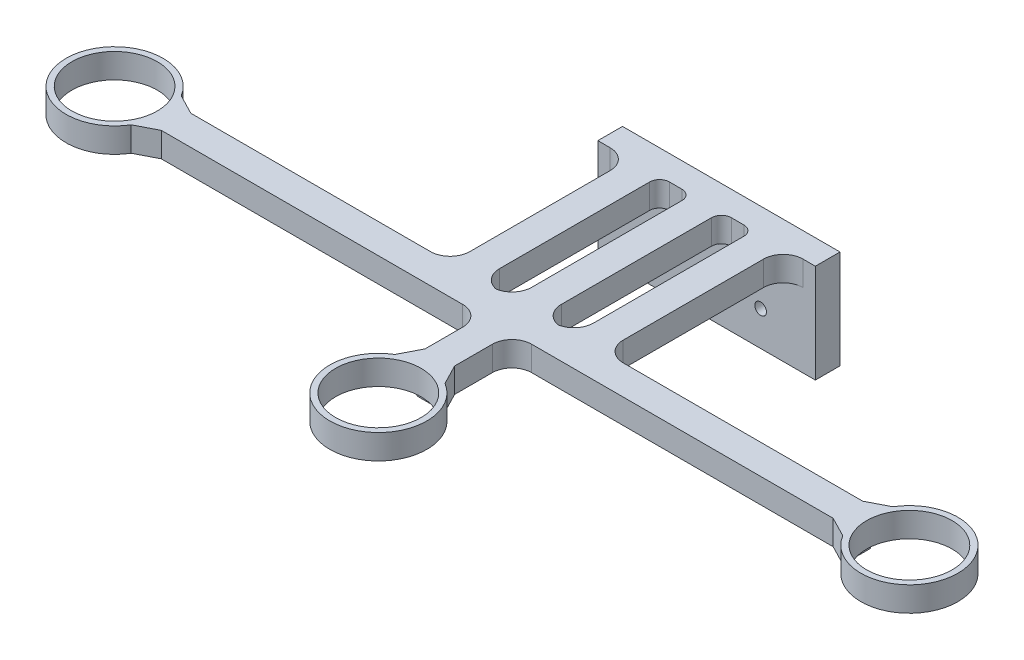
from build123d import *

# Parameters (mm, degrees)
SKETCH1_W           = 55.99938
SKETCH1_H           = 25.4
BOSS_EXTRUDE1_DEPTH = 6.35
BOSS_EXTRUDE2_DEPTH = 6.35
SKETCH10_R          = 10.999999971
CUT_EXTRUDE3_DEPTH  = 179.12779542
FILLET1_R           = 5.08
FILLET2_R           = 5.08
FILLET3_R           = 5.08
FILLET4_R           = 5.08
FILLET5_R           = 5.08
FILLET6_R           = 5.08
FILLET7_R           = 2.54
SKETCH9_R           = 1.5
CUT_EXTRUDE2_DEPTH  = 175.519471736
BOSS_EXTRUDE3_DEPTH = 1.27
FILLET8_R           = 1.27
CHAMFER1_SIZE       = 3.922074982
CHAMFER3_SIZE       = 3.922074982
CHAMFER4_SIZE       = 3.922074982


with BuildPart() as part:
    # Sketch1 → Boss-Extrude1 (new body)
    with BuildSketch(Plane.XY):
        with Locations((27.99969, -12.7)):
            Rectangle(SKETCH1_W, SKETCH1_H)
    extrude(amount=BOSS_EXTRUDE1_DEPTH)

    # Sketch2 → Boss-Extrude2 (add)
    with BuildSketch(Plane(origin=(0, 0, 0), x_dir=(1, 0, 0), z_dir=(0, 1, 0))):
        with BuildLine():
            ThreePointArc((118.420471835, -60.26605485), (142.825676579, -56.45605485), (118.420471835, -52.64605485))
            Line((118.420471835, -52.64605485), (47.74438, -52.64605485))
            Line((47.74438, -52.64605485), (47.74438, -6.35))
            Line((47.74438, -6.35), (40.124318317, -6.35))
            Line((40.124318317, -6.35), (40.124318317, -52.64605485))
            Line((40.124318317, -52.64605485), (31.80969, -52.64605485))
            Line((31.80969, -52.64605485), (31.80969, -6.35))
            Line((31.80969, -6.35), (24.18969, -6.35))
            Line((24.18969, -6.35), (24.18969, -52.64605485))
            Line((24.18969, -52.64605485), (15.882493554, -52.64605485))
            Line((15.882493554, -52.64605485), (15.882493554, -6.35))
            Line((15.882493554, -6.35), (8.262493554, -6.35))
            Line((8.262493554, -6.35), (8.262493554, -52.64605485))
            Line((8.262493554, -52.64605485), (-62.421091835, -52.64605485))
            ThreePointArc((-62.421091835, -52.64605485), (-86.826296579, -56.45605485), (-62.421091835, -60.26605485))
            Line((-62.421091835, -60.26605485), (24.18969, -60.26605485))
            Line((24.18969, -60.26605485), (24.18969, -78.963928031))
            ThreePointArc((24.18969, -78.963928031), (27.99969, -103.369132775), (31.80969, -78.963928031))
            Line((31.80969, -78.963928031), (31.80969, -60.26605485))
            Line((31.80969, -60.26605485), (118.420471835, -60.26605485))
        make_face()
    extrude(amount=-BOSS_EXTRUDE2_DEPTH)

    # Sketch10 → Cut-Extrude3 (cut, through all)
    with BuildSketch(Plane(origin=(0, 0, 0), x_dir=(1, 0, 0), z_dir=(0, 1, 0))):
        with Locations(Location((-74.326296579, -56.45605485, 0), (0, 0, 270))):
            Circle(SKETCH10_R)
        with Locations(Location((27.99969, -90.869132775, 0), (0, 0, 270))):
            Circle(SKETCH10_R)
        with Locations(Location((130.325676579, -56.45605485, 0), (0, 0, 270))):
            Circle(SKETCH10_R)
    extrude(amount=-CUT_EXTRUDE3_DEPTH, mode=Mode.SUBTRACT)

    # Fillet1
    fillet1_edges = [part.edges().sort_by_distance(p)[0] for p in [
        (8.262493554, -3.175, 6.35),
    ]]
    fillet(fillet1_edges, radius=FILLET1_R)

    # Fillet2
    fillet2_edges = [part.edges().sort_by_distance(p)[0] for p in [
        (47.74438, -3.175, 6.35),
    ]]
    fillet(fillet2_edges, radius=FILLET2_R)

    # Fillet3
    fillet3_edges = [part.edges().sort_by_distance(p)[0] for p in [
        (47.74438, -3.175, 52.64605485),
    ]]
    fillet(fillet3_edges, radius=FILLET3_R)

    # Fillet4
    fillet4_edges = [part.edges().sort_by_distance(p)[0] for p in [
        (8.262493554, -3.175, 52.64605485),
    ]]
    fillet(fillet4_edges, radius=FILLET4_R)

    # Fillet5
    fillet5_edges = [part.edges().sort_by_distance(p)[0] for p in [
        (31.80969, -3.175, 60.26605485),
        (24.18969, -3.175, 60.26605485),
    ]]
    fillet(fillet5_edges, radius=FILLET5_R)

    # Fillet6
    # the kernel refuses this fillet: 5.08 mm, written as the material it adds along each edge
    with BuildSketch(Plane(origin=(40.124318317, 0, 52.64605485), x_dir=(0, 0, -1), z_dir=(0, -1, 0)), Plane(origin=(24.18969, 0, 52.64605485), x_dir=(0, 0, -1), z_dir=(0, -1, 0))) as fillet6_piece_1:
        with BuildLine():
            CenterArc((FILLET6_R, -FILLET6_R), FILLET6_R, 90, 90)
            Line((0, -FILLET6_R), (0, 0))
            Line((0, 0), (FILLET6_R, 0))
        make_face()
    extrude(amount=6.35)
    with BuildSketch(Plane(origin=(31.80969, 0, 52.64605485), x_dir=(0, 0, -1), z_dir=(0, -1, 0)), Plane(origin=(15.882493554, 0, 52.64605485), x_dir=(0, 0, -1), z_dir=(0, -1, 0))) as fillet6_piece_2:
        with BuildLine():
            CenterArc((FILLET6_R, FILLET6_R), FILLET6_R, 180, 90)
            Line((0, FILLET6_R), (0, 0))
            Line((0, 0), (FILLET6_R, 0))
        make_face()
    extrude(amount=6.35)

    # Fillet7
    fillet7_edges = [part.edges().sort_by_distance(p)[0] for p in [
        (15.882493554, -3.175, 6.35),
        (24.18969, -3.175, 6.35),
        (31.80969, -3.175, 6.35),
        (40.124318317, -3.175, 6.35),
    ]]
    fillet(fillet7_edges, radius=FILLET7_R)

    # Sketch9 → Cut-Extrude2 (cut, through all)
    with BuildSketch(Plane.XY.offset(6.35)):
        with Locations((13.97, -16.51)):
            Circle(SKETCH9_R)
        with Locations((41.91, -16.51)):
            Circle(SKETCH9_R)
    extrude(amount=-CUT_EXTRUDE2_DEPTH, mode=Mode.SUBTRACT)

    # Sketch13 → Boss-Extrude3 (add)
    with BuildSketch(Plane.XZ.offset(6.35)):
        Polygon((-62.421091835, 58.361061908), (-62.421091835, 54.55105485), (10.160000409, 54.55105485), (10.160000409, 6.35), (13.97, 6.35), (13.946786012, 37.440717912), (13.946786012, 54.55105485), (26.09469, 54.55105485), (26.09469, 6.35), (29.90469, 6.35), (29.90469, 54.55105485), (42.02938, 54.55105485), (42.02938, 6.35), (45.83938, 6.35), (45.83938, 54.55105485), (118.420471835, 54.55105485), (118.420471835, 58.361061908), (29.90469, 58.361061908), (29.90469, 78.963928031), (26.09469, 78.963928031), (26.09469, 58.361061908), align=None)
    extrude(amount=BOSS_EXTRUDE3_DEPTH)

    # Fillet8
    fillet8_edges = [part.edges().sort_by_distance(p)[0] for p in [
        (10.160000409, -6.985, 6.35),
        (13.97, -6.985, 6.35),
        (42.02938, -6.985, 6.35),
        (45.83938, -6.985, 6.35),
        (26.09469, -6.985, 6.35),
        (29.90469, -6.985, 6.35),
    ]]
    fillet(fillet8_edges, radius=FILLET8_R)

    # Chamfer1
    # the kernel refuses this chamfer: 3.922074982, 2.54 mm, written as the material it adds along each edge
    with BuildSketch(Plane(origin=(-62.421091835, 0, 52.64605485), x_dir=(1, 0, 0), z_dir=(0, -1, 0))) as chamfer1_piece_1:
        with BuildLine():
            Line((CHAMFER1_SIZE, 0), (-1.195552336, -2.636188431))
            ThreePointArc((-1.195552336, -2.636188431), (-0.547031751, -1.409377958), (0, 0))
            Line((0, 0), (CHAMFER1_SIZE, 0))
        make_face()
    extrude(amount=6.35)
    with BuildSketch(Plane(origin=(-62.421091835, 0, 60.26605485), x_dir=(-0.4130254162108394, 0, 0.9107194988380687), z_dir=(0, -1, 0))) as chamfer1_piece_2:
        with BuildLine():
            Line((2.894621708, 0), (-CHAMFER1_SIZE * 0.413025416196, -CHAMFER1_SIZE * 0.910719498804))
            Line((-CHAMFER1_SIZE * 0.413025416196, -CHAMFER1_SIZE * 0.910719498804), (0, 0))
            ThreePointArc((0, 0), (1.509486004, -0.083916435), (2.894621708, 0))
        make_face()
    extrude(amount=6.35)

    # Chamfer3
    # the kernel refuses this chamfer: 3.922074982, 2.54 mm, written as the material it adds along each edge
    with BuildSketch(Plane(origin=(118.420471835, 0, 52.64605485), x_dir=(0.4130254162108416, 0, -0.9107194988380676), z_dir=(0, -1, 0))) as chamfer3_piece_1:
        with BuildLine():
            Line((2.894621708, 0), (-CHAMFER3_SIZE * 0.413025416196, -CHAMFER3_SIZE * 0.910719498804))
            Line((-CHAMFER3_SIZE * 0.413025416196, -CHAMFER3_SIZE * 0.910719498804), (0, 0))
            ThreePointArc((0, 0), (1.509486004, -0.083916435), (2.894621708, 0))
        make_face()
    extrude(amount=6.35)
    with BuildSketch(Plane(origin=(118.420471835, 0, 60.26605485), x_dir=(-1, 0, 0), z_dir=(0, -1, 0))) as chamfer3_piece_2:
        with BuildLine():
            Line((CHAMFER3_SIZE, 0), (-1.195552336, -2.636188431))
            ThreePointArc((-1.195552336, -2.636188431), (-0.547031751, -1.409377958), (0, 0))
            Line((0, 0), (CHAMFER3_SIZE, 0))
        make_face()
    extrude(amount=6.35)

    # Chamfer4
    # the kernel refuses this chamfer: 3.922074982, 2.54 mm, written as the material it adds along each edge
    with BuildSketch(Plane(origin=(31.80969, 0, 78.963928031), x_dir=(0.9107194988380676, 0, 0.4130254162108416), z_dir=(0, -1, 0))) as chamfer4_piece_1:
        with BuildLine():
            Line((2.894621708, 0), (-CHAMFER4_SIZE * 0.413025416196, -CHAMFER4_SIZE * 0.910719498804))
            Line((-CHAMFER4_SIZE * 0.413025416196, -CHAMFER4_SIZE * 0.910719498804), (0, 0))
            ThreePointArc((0, 0), (1.509486004, -0.083916435), (2.894621708, 0))
        make_face()
    extrude(amount=6.35)
    with BuildSketch(Plane(origin=(24.18969, 0, 78.963928031), x_dir=(0, 0, -1), z_dir=(0, -1, 0))) as chamfer4_piece_2:
        with BuildLine():
            Line((CHAMFER4_SIZE, 0), (-1.195552336, -2.636188431))
            ThreePointArc((-1.195552336, -2.636188431), (-0.547031751, -1.409377958), (0, 0))
            Line((0, 0), (CHAMFER4_SIZE, 0))
        make_face()
    extrude(amount=6.35)


solid = part.part
